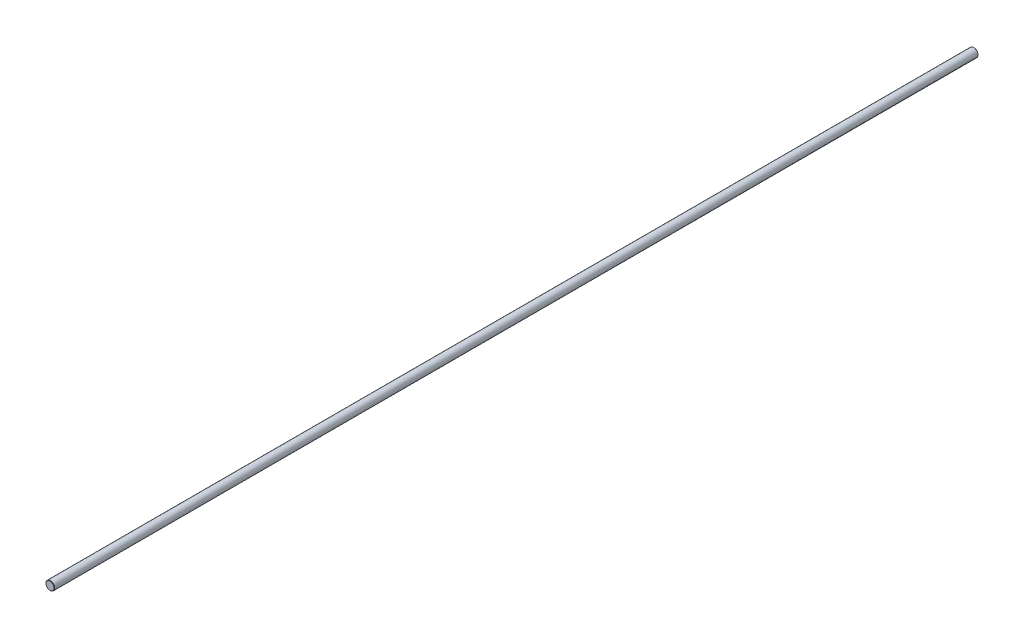
from build123d import *

# Parameters (mm, degrees)
SCHIZZO1_R                   = 3
ESTRUSIONE_ESTRUSIONE1_DEPTH = 640
SMUSSO1_SIZE                 = 0.25


with BuildPart() as part:
    # Schizzo1 → Estrusione-Estrusione1 (new body)
    with BuildSketch(Plane.XY):
        Circle(SCHIZZO1_R)
    extrude(amount=ESTRUSIONE_ESTRUSIONE1_DEPTH)

    # Smusso1
    smusso1_edges = [part.edges().sort_by_distance(p)[0] for p in [
        (-3, 0, 0),
        (-3, 0, 640),
    ]]
    chamfer(smusso1_edges, length=SMUSSO1_SIZE)


solid = part.part
